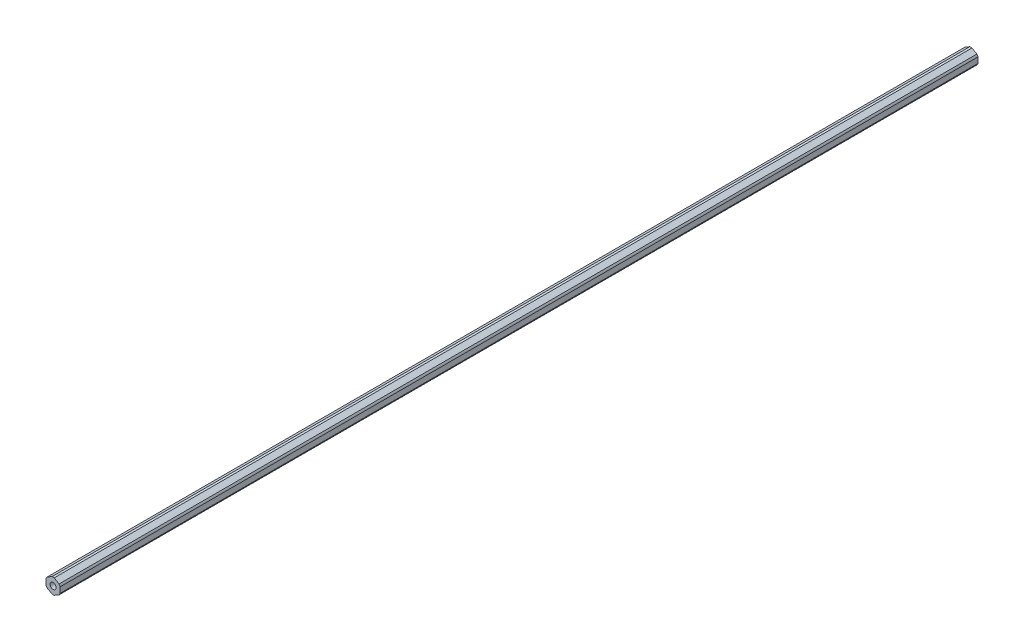
from build123d import *

# Parameters (mm, degrees)
SKETCH2_R                            = 2.0193
BOSS_EXTRUDE1_DEPTH                  = 307.871999952
F_10_32_TAPPED_HOLE2_D               = 4.0386
F_10_32_TAPPED_HOLE2_DEPTH           = 16.34744
F_10_32_TAPPED_HOLE2_TIP             = 1.213317848
F_10_32_TAPPED_HOLE2_ON_FACE_2_D     = 4.0386
F_10_32_TAPPED_HOLE2_ON_FACE_2_DEPTH = 16.34744
F_10_32_TAPPED_HOLE2_ON_FACE_2_TIP   = 1.213317848


with BuildPart() as part:
    # Sketch2 → Boss-Extrude1 (new, symmetric)
    with BuildSketch(Plane.XY):
        with BuildLine():
            ThreePointArc((0.741687758, 5.071047688), (0, 5.125000037), (-0.741687758, 5.071047688))
            Line((-0.741687758, 5.071047688), (-4.020812242, 3.177844283))
            ThreePointArc((-4.020812242, 3.177844283), (-4.438380226, 2.562500019), (-4.7625, 1.893203404))
            Line((-4.7625, 1.893203404), (-4.7625, -1.893203404))
            ThreePointArc((-4.7625, -1.893203404), (-4.438380226, -2.562500019), (-4.020812242, -3.177844283))
            Line((-4.020812242, -3.177844283), (-0.741687758, -5.071047688))
            ThreePointArc((-0.741687758, -5.071047688), (0, -5.125000037), (0.741687758, -5.071047688))
            Line((0.741687758, -5.071047688), (4.020812242, -3.177844283))
            ThreePointArc((4.020812242, -3.177844283), (4.438380226, -2.562500019), (4.7625, -1.893203404))
            Line((4.7625, -1.893203404), (4.7625, 1.893203404))
            ThreePointArc((4.7625, 1.893203404), (4.438380226, 2.562500019), (4.020812242, 3.177844283))
            Line((4.020812242, 3.177844283), (0.741687758, 5.071047688))
        make_face()
        Circle(SKETCH2_R, mode=Mode.SUBTRACT)
    extrude(amount=BOSS_EXTRUDE1_DEPTH, both=True)

    # #10-32 Tapped Hole2
    with Locations(Plane(origin=(0, 0, -307.871999952), x_dir=(-1, 0, 0), z_dir=(0, 0, -1))):
        with Locations((0, 0)):
            Hole(F_10_32_TAPPED_HOLE2_D / 2, depth=F_10_32_TAPPED_HOLE2_DEPTH)
            with Locations((0, 0, -(F_10_32_TAPPED_HOLE2_DEPTH + F_10_32_TAPPED_HOLE2_TIP / 2))):  # 118° drill point
                Cone(0, F_10_32_TAPPED_HOLE2_D / 2, F_10_32_TAPPED_HOLE2_TIP, mode=Mode.SUBTRACT)

    # #10-32 Tapped Hole2 on face 2
    with Locations(Plane(origin=(0, 0, 307.871999952), x_dir=(-1, 0, 0), z_dir=(0, 0, -1))):
        with Locations((0, 0)):
            Hole(F_10_32_TAPPED_HOLE2_ON_FACE_2_D / 2, depth=F_10_32_TAPPED_HOLE2_ON_FACE_2_DEPTH)
            with Locations((0, 0, -(F_10_32_TAPPED_HOLE2_ON_FACE_2_DEPTH + F_10_32_TAPPED_HOLE2_ON_FACE_2_TIP / 2))):  # 118° drill point
                Cone(0, F_10_32_TAPPED_HOLE2_ON_FACE_2_D / 2, F_10_32_TAPPED_HOLE2_ON_FACE_2_TIP, mode=Mode.SUBTRACT)


solid = part.part
